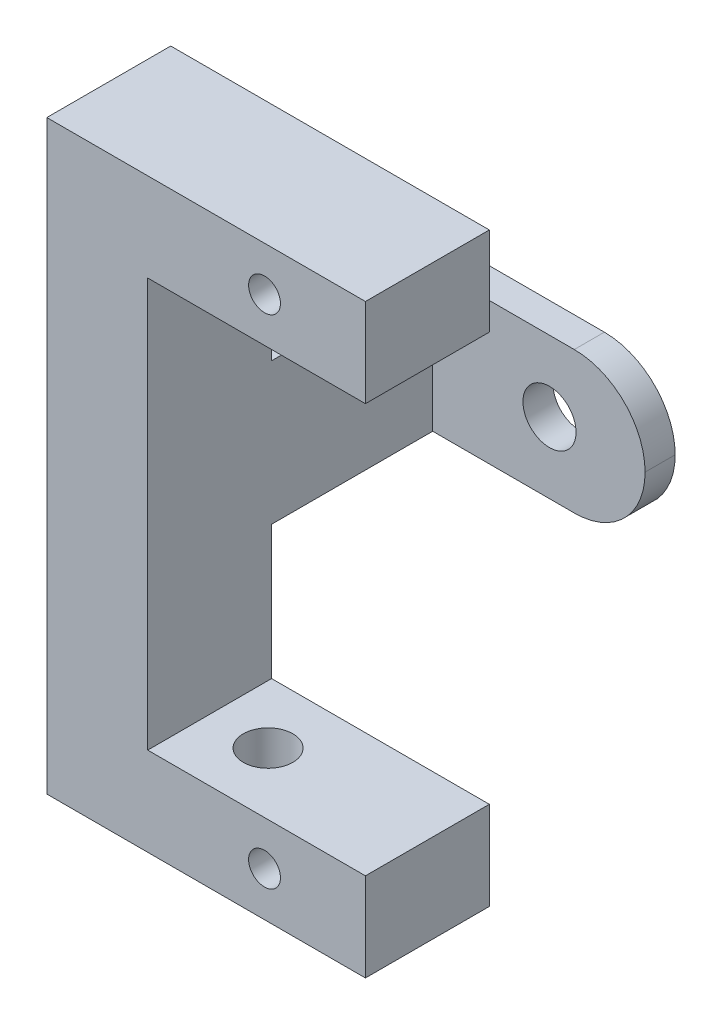
from build123d import *

# Parameters (mm, degrees)
ESTRUSIONE_ESTRUSIONE1_DEPTH = 7
SCHIZZO2_R                   = 0.9
TAGLIO_ESTRUSIONE1_DEPTH     = 21.420394218
TAGLIO_ESTRUSIONE2_REACH     = 37.195
SCHIZZO3_R                   = 1.4
SCHIZZO4_W                   = 5.7
SCHIZZO4_H                   = 8
ESTRUSIONE_ESTRUSIONE2_DEPTH = 10.8
SCHIZZO5_W                   = 1.7
SCHIZZO5_H                   = 8
ESTRUSIONE_ESTRUSIONE3_DEPTH = 12
RACCORDO1_R                  = 4
TAGLIO_ESTRUSIONE3_REACH     = 28.169
SCHIZZO6_R                   = 1.5


with BuildPart() as part:
    # Schizzo1 → Estrusione-Estrusione1 (new body)
    with BuildSketch(Plane.XY):
        Polygon((8.3, 11.55), (-4, 11.55), (-4, -11.55), (8.3, -11.55), (8.3, -16.55), (-9.7, -16.55), (-9.7, 16.55), (8.3, 16.55), align=None)
    extrude(amount=ESTRUSIONE_ESTRUSIONE1_DEPTH)

    # Schizzo2 → Taglio-Estrusione1 (cut, through all)
    with BuildSketch(Plane.XY.offset(7)):
        with Locations((2.6, 14.05)):
            Circle(SCHIZZO2_R)
        with Locations(Location((2.6, -14.05, 0), (0, 0, 180))):
            Circle(SCHIZZO2_R)
    extrude(amount=-TAGLIO_ESTRUSIONE1_DEPTH, mode=Mode.SUBTRACT)

    # Schizzo3 → Taglio-Estrusione2 (cut, up to next)
    with BuildSketch(Plane.XZ.offset(16.55), mode=Mode.PRIVATE) as taglio_estrusione2_sk1:
        with Locations(Location((-0.7, 3.5, 0), (0, 0, 270))):
            Circle(SCHIZZO3_R)
    taglio_estrusione2_tool1 = extrude(taglio_estrusione2_sk1.sketch, amount=-TAGLIO_ESTRUSIONE2_REACH, mode=Mode.PRIVATE) & part.part
    add(taglio_estrusione2_tool1.solids().sort_by_distance((-0.7, -16.55, 3.5))[0], mode=Mode.SUBTRACT)

    # Schizzo4 → Estrusione-Estrusione2 (add)
    with BuildSketch(Plane(origin=(0, 0, 0), x_dir=(-1, 0, 0), z_dir=(0, 0, -1))):
        with Locations((6.85, 0)):
            Rectangle(SCHIZZO4_W, SCHIZZO4_H)
    extrude(amount=ESTRUSIONE_ESTRUSIONE2_DEPTH)

    # Schizzo5 → Estrusione-Estrusione3 (add)
    with BuildSketch(Plane(origin=(-4, 0, 0), x_dir=(0, 0, -1), z_dir=(1, 0, 0))):
        with Locations((9.95, 0)):
            Rectangle(SCHIZZO5_W, SCHIZZO5_H)
    extrude(amount=ESTRUSIONE_ESTRUSIONE3_DEPTH)

    # Raccordo1
    raccordo1_edges = [part.edges().sort_by_distance(p)[0] for p in [
        (8, 4, -9.95),
        (8, -4, -9.95),
    ]]
    fillet(raccordo1_edges, radius=RACCORDO1_R - 0.0001)  # a hair under: the kernel refuses the full size

    # Schizzo6 → Taglio-Estrusione3 (cut, up to next)
    with BuildSketch(Plane(origin=(0, 0, -10.8), x_dir=(-1, 0, 0), z_dir=(0, 0, -1)), mode=Mode.PRIVATE) as taglio_estrusione3_sk1:
        with Locations((-2.6, 0)):
            Circle(SCHIZZO6_R)
    taglio_estrusione3_tool1 = extrude(taglio_estrusione3_sk1.sketch, amount=-TAGLIO_ESTRUSIONE3_REACH, mode=Mode.PRIVATE) & part.part
    add(taglio_estrusione3_tool1.solids().sort_by_distance((2.6, 0, -10.8))[0], mode=Mode.SUBTRACT)


solid = part.part
